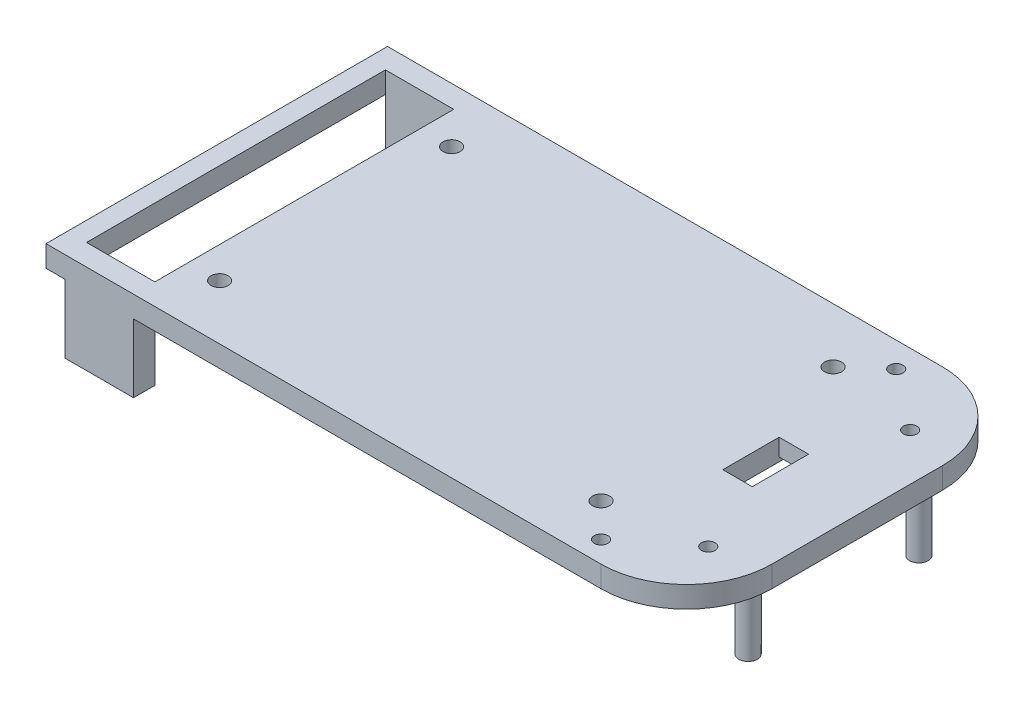
from build123d import *

# Parameters (mm, degrees)
CROQUIS2_R              = 2
CROQUIS2_R_2            = 1.5875
CROQUIS2_R_3            = 2.175
CROQUIS2_W              = 16
CROQUIS2_H              = 70
SALIENTE_EXTRUIR1_DEPTH = 5
CROQUIS2_3_W            = 16
CROQUIS2_3_H            = 5
CROQUIS2_3_R            = 2.175
SALIENTE_EXTRUIR2_DEPTH = 21
CROQUIS4_W              = 6.902544823
CROQUIS4_H              = 13.181281006
CORTAR_EXTRUIR1_DEPTH   = 5
CROQUIS4_3_W            = 6.902544823
CROQUIS4_3_H            = 2.299613284
CORTAR_EXTRUIR2_DEPTH   = 1


with BuildPart() as part:
    # Croquis2 → Saliente-Extruir1 (new body)
    with BuildSketch(Plane(origin=(0, 0, 0), x_dir=(1, 0, 0), z_dir=(0, 1, 0))):
        with BuildLine():
            Line((-75, 40), (-75, -40))
            Line((-75, -40), (55, -40))
            ThreePointArc((55, -40), (69.142135624, -34.142135624), (75, -20))
            Line((75, -20), (75, 20))
            ThreePointArc((75, 20), (69.142135624, 34.142135624), (55, 40))
            Line((55, 40), (-75, 40))
        make_face()
        with Locations(Location((-47.171572875, -27.171572875, 0), (0, 0, 270))):
            Circle(CROQUIS2_R, mode=Mode.SUBTRACT)
        with Locations(Location((50, -35, 0), (0, 0, 270))):
            Circle(CROQUIS2_R_2, mode=Mode.SUBTRACT)
        with Locations(Location((42.171572875, -27.171572875, 0), (0, 0, 270))):
            Circle(CROQUIS2_R, mode=Mode.SUBTRACT)
        with Locations(Location((64, -23.888995042, 0), (0, 0, 270))):
            Circle(CROQUIS2_R_2, mode=Mode.SUBTRACT)
        with Locations(Location((69.44817995, -20, 0), (0, 0, 270))):
            Circle(CROQUIS2_R_3, mode=Mode.SUBTRACT)
        with Locations((-62.5, 0)):
            Rectangle(CROQUIS2_W, CROQUIS2_H, mode=Mode.SUBTRACT)
        with Locations(Location((-47.171572875, 27.171572875, 0), (0, 0, 270))):
            Circle(CROQUIS2_R, mode=Mode.SUBTRACT)
        with BuildLine():
            Line((54.218575207, 2.358517529), (54.281519289, 2.234982813))
            Line((54.281519289, 2.234982813), (54.405054005, 2.297926895))
            ThreePointArc((54.405054005, 2.297926895), (54.433330829, 2.287272045), (54.46147409, 2.276269253))
            Line((54.46147409, 2.276269253), (54.511160464, 2.146831825))
            Line((54.511160464, 2.146831825), (54.640597892, 2.196518199))
            ThreePointArc((54.640597892, 2.196518199), (54.667606077, 2.182965984), (54.694445062, 2.169081695))
            Line((54.694445062, 2.169081695), (54.730329352, 2.035159699))
            Line((54.730329352, 2.035159699), (54.864251349, 2.07104399))
            ThreePointArc((54.864251349, 2.07104399), (54.889694988, 2.054742891), (54.914935643, 2.038129224))
            Line((54.914935643, 2.038129224), (54.936624695, 1.901189937))
            Line((54.936624695, 1.901189937), (55.073563983, 1.922878989))
            ThreePointArc((55.073563983, 1.922878989), (55.09716431, 1.904007606), (55.120530093, 1.884846583))
            Line((55.120530093, 1.884846583), (55.127786277, 1.74639034))
            Line((55.127786277, 1.74639034), (55.26624252, 1.753646524))
            ThreePointArc((55.26624252, 1.753646524), (55.287740966, 1.732411614), (55.308975876, 1.710913168))
            Line((55.308975876, 1.710913168), (55.301719692, 1.572456925))
            Line((55.301719692, 1.572456925), (55.440175935, 1.565200741))
            ThreePointArc((55.440175935, 1.565200741), (55.459336958, 1.541834958), (55.478208342, 1.51823463))
            Line((55.478208342, 1.51823463), (55.456519289, 1.381295343))
            Line((55.456519289, 1.381295343), (55.593458577, 1.35960629))
            ThreePointArc((55.593458577, 1.35960629), (55.610072244, 1.334365636), (55.626373342, 1.308921996))
            Line((55.626373342, 1.308921996), (55.590489051, 1.175))
            Line((55.590489051, 1.175), (55.724411048, 1.139115709))
            ThreePointArc((55.724411048, 1.139115709), (55.738295337, 1.112276724), (55.751847551, 1.085268539))
            Line((55.751847551, 1.085268539), (55.702161178, 0.955831111))
            Line((55.702161178, 0.955831111), (55.831598606, 0.906144738))
            ThreePointArc((55.831598606, 0.906144738), (55.842601397, 0.878001476), (55.853256247, 0.849724653))
            Line((55.853256247, 0.849724653), (55.790312166, 0.726189937))
            Line((55.790312166, 0.726189937), (55.913846882, 0.663245855))
            ThreePointArc((55.913846882, 0.663245855), (55.921847627, 0.634106661), (55.929488376, 0.604871005))
            Line((55.929488376, 0.604871005), (55.853976214, 0.488592473))
            Line((55.853976214, 0.488592473), (55.970254746, 0.413080312))
            ThreePointArc((55.970254746, 0.413080312), (55.975165787, 0.383264439), (55.979708721, 0.353390264))
            Line((55.979708721, 0.353390264), (55.892455806, 0.245641889))
            Line((55.892455806, 0.245641889), (56.000204182, 0.158388975))
            ThreePointArc((56.000204182, 0.158388975), (56.001971713, 0.128223093), (56.003367058, 0.098037706))
            Line((56.003367058, 0.098037706), (55.905329352, 0))
            Line((55.905329352, 0), (56.003367058, -0.098037706))
            ThreePointArc((56.003367058, -0.098037706), (56.001971713, -0.128223093), (56.000204182, -0.158388975))
            Line((56.000204182, -0.158388975), (55.892455806, -0.245641889))
            Line((55.892455806, -0.245641889), (55.979708721, -0.353390264))
            ThreePointArc((55.979708721, -0.353390264), (55.975165787, -0.383264439), (55.970254746, -0.413080312))
            Line((55.970254746, -0.413080312), (55.853976214, -0.488592473))
            Line((55.853976214, -0.488592473), (55.929488376, -0.604871005))
            ThreePointArc((55.929488376, -0.604871005), (55.921847627, -0.634106661), (55.913846882, -0.663245855))
            Line((55.913846882, -0.663245855), (55.790312166, -0.726189937))
            Line((55.790312166, -0.726189937), (55.853256247, -0.849724653))
            ThreePointArc((55.853256247, -0.849724653), (55.842601397, -0.878001476), (55.831598606, -0.906144738))
            Line((55.831598606, -0.906144738), (55.702161178, -0.955831111))
            Line((55.702161178, -0.955831111), (55.751847551, -1.085268539))
            ThreePointArc((55.751847551, -1.085268539), (55.738295337, -1.112276724), (55.724411048, -1.139115709))
            Line((55.724411048, -1.139115709), (55.590489051, -1.175))
            Line((55.590489051, -1.175), (55.626373342, -1.308921996))
            ThreePointArc((55.626373342, -1.308921996), (55.610072244, -1.334365636), (55.593458577, -1.35960629))
            Line((55.593458577, -1.35960629), (55.456519289, -1.381295343))
            Line((55.456519289, -1.381295343), (55.478208342, -1.51823463))
            ThreePointArc((55.478208342, -1.51823463), (55.459336958, -1.541834958), (55.440175935, -1.565200741))
            Line((55.440175935, -1.565200741), (55.301719692, -1.572456925))
            Line((55.301719692, -1.572456925), (55.308975876, -1.710913168))
            ThreePointArc((55.308975876, -1.710913168), (55.287740966, -1.732411614), (55.26624252, -1.753646524))
            Line((55.26624252, -1.753646524), (55.127786277, -1.74639034))
            Line((55.127786277, -1.74639034), (55.120530093, -1.884846583))
            ThreePointArc((55.120530093, -1.884846583), (55.09716431, -1.904007606), (55.073563983, -1.922878989))
            Line((55.073563983, -1.922878989), (54.936624695, -1.901189937))
            Line((54.936624695, -1.901189937), (54.914935643, -2.038129224))
            ThreePointArc((54.914935643, -2.038129224), (54.889694988, -2.054742891), (54.864251349, -2.07104399))
            Line((54.864251349, -2.07104399), (54.730329352, -2.035159699))
            Line((54.730329352, -2.035159699), (54.694445062, -2.169081695))
            ThreePointArc((54.694445062, -2.169081695), (54.667606077, -2.182965984), (54.640597892, -2.196518199))
            Line((54.640597892, -2.196518199), (54.511160464, -2.146831825))
            Line((54.511160464, -2.146831825), (54.46147409, -2.276269253))
            ThreePointArc((54.46147409, -2.276269253), (54.433330829, -2.287272045), (54.405054005, -2.297926895))
            Line((54.405054005, -2.297926895), (54.281519289, -2.234982813))
            Line((54.281519289, -2.234982813), (54.218575207, -2.358517529))
            ThreePointArc((54.218575207, -2.358517529), (54.189436013, -2.366518274), (54.160200358, -2.374159023))
            Line((54.160200358, -2.374159023), (54.043921826, -2.298646862))
            Line((54.043921826, -2.298646862), (53.968409664, -2.414925393))
            ThreePointArc((53.968409664, -2.414925393), (53.938593792, -2.419836434), (53.908719617, -2.424379368))
            Line((53.908719617, -2.424379368), (53.800971241, -2.337126454))
            Line((53.800971241, -2.337126454), (53.713718327, -2.44487483))
            ThreePointArc((53.713718327, -2.44487483), (53.683552445, -2.44664236), (53.653367058, -2.448037706))
            Line((53.653367058, -2.448037706), (53.555329352, -2.35))
            Line((53.555329352, -2.35), (53.457291647, -2.448037706))
            ThreePointArc((53.457291647, -2.448037706), (53.42710626, -2.44664236), (53.396940378, -2.44487483))
            Line((53.396940378, -2.44487483), (53.309687464, -2.337126454))
            Line((53.309687464, -2.337126454), (53.201939088, -2.424379368))
            ThreePointArc((53.201939088, -2.424379368), (53.172064913, -2.419836434), (53.14224904, -2.414925393))
            Line((53.14224904, -2.414925393), (53.066736879, -2.298646862))
            Line((53.066736879, -2.298646862), (52.950458347, -2.374159023))
            ThreePointArc((52.950458347, -2.374159023), (52.921222692, -2.366518274), (52.892083497, -2.358517529))
            Line((52.892083497, -2.358517529), (52.829139416, -2.234982813))
            Line((52.829139416, -2.234982813), (52.7056047, -2.297926895))
            ThreePointArc((52.7056047, -2.297926895), (52.677327876, -2.287272045), (52.649184615, -2.276269253))
            Line((52.649184615, -2.276269253), (52.599498241, -2.146831825))
            Line((52.599498241, -2.146831825), (52.470060813, -2.196518199))
            ThreePointArc((52.470060813, -2.196518199), (52.443052628, -2.182965984), (52.416213643, -2.169081695))
            Line((52.416213643, -2.169081695), (52.380329352, -2.035159699))
            Line((52.380329352, -2.035159699), (52.246407356, -2.07104399))
            ThreePointArc((52.246407356, -2.07104399), (52.220963717, -2.054742891), (52.195723062, -2.038129224))
            Line((52.195723062, -2.038129224), (52.174034009, -1.901189937))
            Line((52.174034009, -1.901189937), (52.037094722, -1.922878989))
            ThreePointArc((52.037094722, -1.922878989), (52.013494394, -1.904007606), (51.990128612, -1.884846583))
            Line((51.990128612, -1.884846583), (51.982872427, -1.74639034))
            Line((51.982872427, -1.74639034), (51.844416184, -1.753646524))
            ThreePointArc((51.844416184, -1.753646524), (51.822917738, -1.732411614), (51.801682828, -1.710913168))
            Line((51.801682828, -1.710913168), (51.808939013, -1.572456925))
            Line((51.808939013, -1.572456925), (51.670482769, -1.565200741))
            ThreePointArc((51.670482769, -1.565200741), (51.651321747, -1.541834958), (51.632450363, -1.51823463))
            Line((51.632450363, -1.51823463), (51.654139416, -1.381295343))
            Line((51.654139416, -1.381295343), (51.517200128, -1.35960629))
            ThreePointArc((51.517200128, -1.35960629), (51.500586461, -1.334365636), (51.484285363, -1.308921996))
            Line((51.484285363, -1.308921996), (51.520169653, -1.175))
            Line((51.520169653, -1.175), (51.386247657, -1.139115709))
            ThreePointArc((51.386247657, -1.139115709), (51.372363368, -1.112276724), (51.358811154, -1.085268539))
            Line((51.358811154, -1.085268539), (51.408497527, -0.955831111))
            Line((51.408497527, -0.955831111), (51.279060099, -0.906144738))
            ThreePointArc((51.279060099, -0.906144738), (51.268057307, -0.878001476), (51.257402457, -0.849724653))
            Line((51.257402457, -0.849724653), (51.320346539, -0.726189937))
            Line((51.320346539, -0.726189937), (51.196811823, -0.663245855))
            ThreePointArc((51.196811823, -0.663245855), (51.188811078, -0.634106661), (51.181170329, -0.604871005))
            Line((51.181170329, -0.604871005), (51.256682491, -0.488592473))
            Line((51.256682491, -0.488592473), (51.140403959, -0.413080312))
            ThreePointArc((51.140403959, -0.413080312), (51.135492918, -0.383264439), (51.130949984, -0.353390264))
            Line((51.130949984, -0.353390264), (51.218202898, -0.245641889))
            Line((51.218202898, -0.245641889), (51.110454523, -0.158388975))
            ThreePointArc((51.110454523, -0.158388975), (51.108686992, -0.128223093), (51.107291647, -0.098037706))
            Line((51.107291647, -0.098037706), (51.205329352, 0))
            Line((51.205329352, 0), (51.107291647, 0.098037706))
            ThreePointArc((51.107291647, 0.098037706), (51.108686992, 0.128223093), (51.110454523, 0.158388975))
            Line((51.110454523, 0.158388975), (51.218202898, 0.245641889))
            Line((51.218202898, 0.245641889), (51.130949984, 0.353390264))
            ThreePointArc((51.130949984, 0.353390264), (51.135492918, 0.383264439), (51.140403959, 0.413080312))
            Line((51.140403959, 0.413080312), (51.256682491, 0.488592473))
            Line((51.256682491, 0.488592473), (51.181170329, 0.604871005))
            ThreePointArc((51.181170329, 0.604871005), (51.188811078, 0.634106661), (51.196811823, 0.663245855))
            Line((51.196811823, 0.663245855), (51.320346539, 0.726189937))
            Line((51.320346539, 0.726189937), (51.257402457, 0.849724653))
            ThreePointArc((51.257402457, 0.849724653), (51.268057307, 0.878001476), (51.279060099, 0.906144738))
            Line((51.279060099, 0.906144738), (51.408497527, 0.955831111))
            Line((51.408497527, 0.955831111), (51.358811154, 1.085268539))
            ThreePointArc((51.358811154, 1.085268539), (51.372363368, 1.112276724), (51.386247657, 1.139115709))
            Line((51.386247657, 1.139115709), (51.520169653, 1.175))
            Line((51.520169653, 1.175), (51.484285363, 1.308921996))
            ThreePointArc((51.484285363, 1.308921996), (51.500586461, 1.334365636), (51.517200128, 1.35960629))
            Line((51.517200128, 1.35960629), (51.654139416, 1.381295343))
            Line((51.654139416, 1.381295343), (51.632450363, 1.51823463))
            ThreePointArc((51.632450363, 1.51823463), (51.651321747, 1.541834958), (51.670482769, 1.565200741))
            Line((51.670482769, 1.565200741), (51.808939013, 1.572456925))
            Line((51.808939013, 1.572456925), (51.801682828, 1.710913168))
            ThreePointArc((51.801682828, 1.710913168), (51.822917738, 1.732411614), (51.844416184, 1.753646524))
            Line((51.844416184, 1.753646524), (51.982872427, 1.74639034))
            Line((51.982872427, 1.74639034), (51.990128612, 1.884846583))
            ThreePointArc((51.990128612, 1.884846583), (52.013494394, 1.904007606), (52.037094722, 1.922878989))
            Line((52.037094722, 1.922878989), (52.174034009, 1.901189937))
            Line((52.174034009, 1.901189937), (52.195723062, 2.038129224))
            ThreePointArc((52.195723062, 2.038129224), (52.220963717, 2.054742891), (52.246407356, 2.07104399))
            Line((52.246407356, 2.07104399), (52.380329352, 2.035159699))
            Line((52.380329352, 2.035159699), (52.416213643, 2.169081695))
            ThreePointArc((52.416213643, 2.169081695), (52.443052628, 2.182965984), (52.470060813, 2.196518199))
            Line((52.470060813, 2.196518199), (52.599498241, 2.146831825))
            Line((52.599498241, 2.146831825), (52.649184615, 2.276269253))
            ThreePointArc((52.649184615, 2.276269253), (52.677327876, 2.287272045), (52.7056047, 2.297926895))
            Line((52.7056047, 2.297926895), (52.829139416, 2.234982813))
            Line((52.829139416, 2.234982813), (52.892083497, 2.358517529))
            ThreePointArc((52.892083497, 2.358517529), (52.921222692, 2.366518274), (52.950458347, 2.374159023))
            Line((52.950458347, 2.374159023), (53.066736879, 2.298646862))
            Line((53.066736879, 2.298646862), (53.14224904, 2.414925393))
            ThreePointArc((53.14224904, 2.414925393), (53.172064913, 2.419836434), (53.201939088, 2.424379368))
            Line((53.201939088, 2.424379368), (53.309687464, 2.337126454))
            Line((53.309687464, 2.337126454), (53.396940378, 2.44487483))
            ThreePointArc((53.396940378, 2.44487483), (53.42710626, 2.44664236), (53.457291647, 2.448037706))
            Line((53.457291647, 2.448037706), (53.555329352, 2.35))
            Line((53.555329352, 2.35), (53.653367058, 2.448037706))
            ThreePointArc((53.653367058, 2.448037706), (53.683552445, 2.44664236), (53.713718327, 2.44487483))
            Line((53.713718327, 2.44487483), (53.800971241, 2.337126454))
            Line((53.800971241, 2.337126454), (53.908719617, 2.424379368))
            ThreePointArc((53.908719617, 2.424379368), (53.938593792, 2.419836434), (53.968409664, 2.414925393))
            Line((53.968409664, 2.414925393), (54.043921826, 2.298646862))
            Line((54.043921826, 2.298646862), (54.160200358, 2.374159023))
            ThreePointArc((54.160200358, 2.374159023), (54.189436013, 2.366518274), (54.218575207, 2.358517529))
        make_face(mode=Mode.SUBTRACT)
        with BuildLine():
            ThreePointArc((60.700997154, 2.278032411), (60.79977304, 1.941142874), (60.882675385, 1.600000035))
            Line((60.882675363, 1.60000003), (60.700997121, 2.2780324))
        make_face(mode=Mode.SUBTRACT)
        with Locations(Location((69.4481799, 20, 0), (0, 0, 270))):
            Circle(CROQUIS2_R_3, mode=Mode.SUBTRACT)
        with Locations(Location((64, 23.397724669, 0), (0, 0, 270))):
            Circle(CROQUIS2_R_2, mode=Mode.SUBTRACT)
        with Locations(Location((42.171572875, 27.171572875, 0), (0, 0, 270))):
            Circle(CROQUIS2_R, mode=Mode.SUBTRACT)
        with Locations(Location((50.003640725, 34.127468235, 0), (0, 0, 270))):
            Circle(CROQUIS2_R_2, mode=Mode.SUBTRACT)
    extrude(amount=-SALIENTE_EXTRUIR1_DEPTH)

    # Croquis2<3> → Saliente-Extruir2 (add)
    with BuildSketch(Plane(origin=(0, 0, 0), x_dir=(1, 0, 0), z_dir=(0, 1, 0))):
        with Locations((-62.5, 37.5)):
            Rectangle(CROQUIS2_3_W, CROQUIS2_3_H)
        with Locations((-62.5, -37.5)):
            Rectangle(CROQUIS2_3_W, CROQUIS2_3_H)
        with Locations(Location((69.4481799, 20, 0), (0, 0, 270))):
            Circle(CROQUIS2_3_R)
        with Locations(Location((69.44817995, -20, 0), (0, 0, 270))):
            Circle(CROQUIS2_3_R)
    extrude(amount=-SALIENTE_EXTRUIR2_DEPTH)

    # Croquis4 → Cortar-Extruir1 (cut)
    with BuildSketch(Plane.XZ.offset(5)):
        with Locations((53.555329353, 0)):
            Rectangle(CROQUIS4_W, CROQUIS4_H)
    extrude(amount=-CORTAR_EXTRUIR1_DEPTH, mode=Mode.SUBTRACT)

    # Croquis4<3> → Cortar-Extruir2 (cut)
    with BuildSketch(Plane.XZ.offset(5)):
        with Locations((53.555329353, 7.740447145)):
            Rectangle(CROQUIS4_3_W, CROQUIS4_3_H)
        with Locations((53.555329353, -7.740447145)):
            Rectangle(CROQUIS4_3_W, CROQUIS4_3_H)
    extrude(amount=-CORTAR_EXTRUIR2_DEPTH, mode=Mode.SUBTRACT)


solid = part.part
